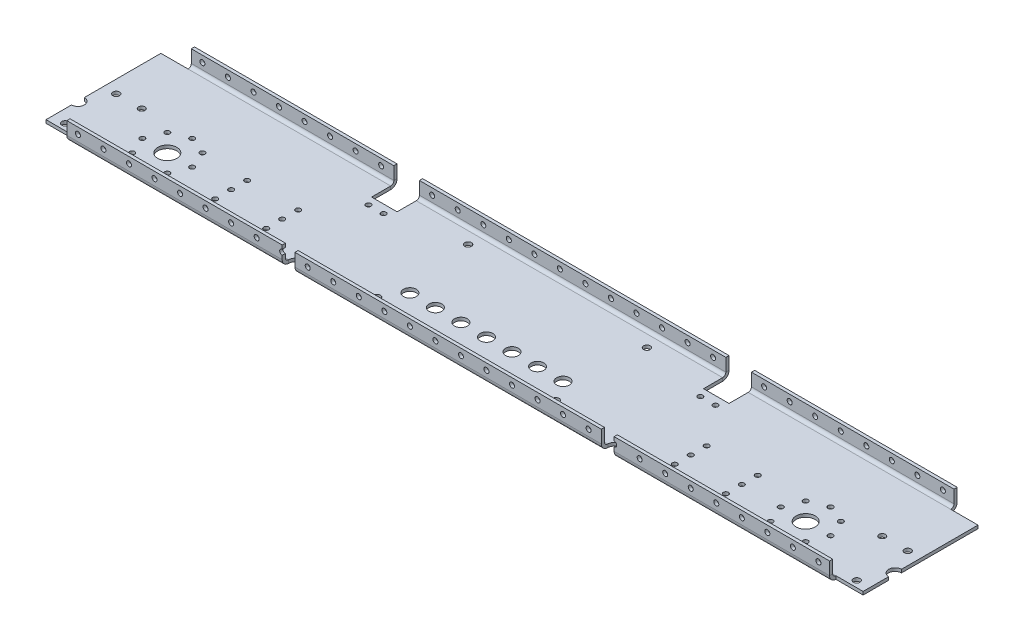
from build123d import *

# Parameters (mm, degrees)
SKETCH1_W                      = 812.8
SKETCH1_H                      = 127
BASE_FLANGE1_DEPTH             = 3.175
EDGE_FLANGE1_STRIP_W           = 19.05
EDGE_FLANGE1_STRIP_H           = 3.175
EDGE_FLANGE1_STRIP_CUT_DEPTH   = 812.8
EDGE_FLANGE1_STRIP_2_W         = 19.05
EDGE_FLANGE1_STRIP_2_H         = 3.175
EDGE_FLANGE1_STRIP_CUT_2_DEPTH = 812.8
EDGE_FLANGE1_DEPTH             = 812.8
EDGE_FLANGE1_BEND_DEPTH        = 812.8
MOUNTING_HOLES_D               = 5
LPATTERN3_COUNT                = 32
LPATTERN3_PITCH                = 25.4
SKETCH21_W                     = 27.051
SKETCH21_H                     = 6.35
SKETCH21_W_2                   = 25.4
SKETCH21_H_2                   = 25.4
CUT_EXTRUDE3_DEPTH             = 412.771918057
CUT_EXTRUDE4_DEPTH             = 412.637250045
CUT_EXTRUDE4_DEPTH_BACK        = 412.637250045
F_80_20_CONNECTION_HOLES_D     = 6.6
MOTOR_HOLES_D                  = 19.05
F_1_2_0_5_DIAMETER_HOLE1_D     = 12.7
CUT_EXTRUDE5_DEPTH             = 412.637250045
CHURROW_HOLES_D                = 6.6
F_80_20_SUPPORT_HOLES_D        = 5
MOTOR_GEARBOX_MOUNTS_D         = 5
F_5_0MM_DOWEL_HOLE3_D          = 5
F_1_4_0_25_DIAMETER_HOLE1_D    = 6.35


# Sheet-metal steps are written as plain solids
with BuildPart() as part:
    # Sketch1 → Base-Flange1 (new body)
    with BuildSketch(Plane(origin=(0, 0, 0), x_dir=(1, 0, 0), z_dir=(0, 1, 0))):
        Rectangle(SKETCH1_W, SKETCH1_H)
    extrude(amount=-BASE_FLANGE1_DEPTH)

    # Edge-Flange1 strip (across the edge) → Edge-Flange1 strip cut (cut)
    with BuildSketch(Plane(origin=(406.4, 0, -63.5), x_dir=(0, 0, 1), z_dir=(-1, 0, 0))):
        with Locations((-3.175, -1.5875)):
            Rectangle(EDGE_FLANGE1_STRIP_W, EDGE_FLANGE1_STRIP_H)
    extrude(amount=EDGE_FLANGE1_STRIP_CUT_DEPTH, mode=Mode.SUBTRACT)

    # Edge-Flange1 strip 2 (across the edge) → Edge-Flange1 strip cut 2 (cut)
    with BuildSketch(Plane(origin=(-406.4, 0, 63.5), x_dir=(0, 0, -1), z_dir=(1, 0, 0))):
        with Locations((-3.175, -1.5875)):
            Rectangle(EDGE_FLANGE1_STRIP_2_W, EDGE_FLANGE1_STRIP_2_H)
    extrude(amount=EDGE_FLANGE1_STRIP_CUT_2_DEPTH, mode=Mode.SUBTRACT)

    # Edge-Flange1 section (across the edge) → Edge-Flange1 (add)
    with BuildSketch(Plane(origin=(406.4, 0, -63.5), x_dir=(0, 0, 1), z_dir=(-1, 0, 0))):
        with BuildLine():
            Line((0, 3.175), (0, 15.875))
            Line((0, 15.875), (3.175, 15.875))
            Line((3.175, 15.875), (3.175, 3.175))
            ThreePointArc((3.175, 3.175), (4.10493597, 0.92993597), (6.35, 0))
            Line((6.35, 0), (6.35, -3.175))
            ThreePointArc((6.35, -3.175), (1.859871939, -1.315128061), (0, 3.175))
        make_face()
    extrude(amount=EDGE_FLANGE1_DEPTH)

    # Edge-Flange1 section 2 (across the edge) → Edge-Flange1 bend (add)
    with BuildSketch(Plane(origin=(-406.4, 0, 63.5), x_dir=(0, 0, -1), z_dir=(1, 0, 0))):
        with BuildLine():
            Line((0, 3.175), (0, 15.875))
            Line((0, 15.875), (3.175, 15.875))
            Line((3.175, 15.875), (3.175, 3.175))
            ThreePointArc((3.175, 3.175), (4.10493597, 0.92993597), (6.35, 0))
            Line((6.35, 0), (6.35, -3.175))
            ThreePointArc((6.35, -3.175), (1.859871939, -1.315128061), (0, 3.175))
        make_face()
    extrude(amount=EDGE_FLANGE1_BEND_DEPTH)

    # Mounting Holes (through all)
    with Locations(Plane(origin=(342.9, 0, -63.5), x_dir=(1, 0, 0), z_dir=(0, 0, -1))):
        with Locations((-736.6, -9.525)):
            mounting_holes = Hole(MOUNTING_HOLES_D / 2)

    # LPattern3: Mounting Holes ×32
    with Locations(*[(i * LPATTERN3_PITCH, 0, 0) for i in range(1, LPATTERN3_COUNT)]):
        add(mounting_holes, mode=Mode.SUBTRACT)

    # Sketch21 → Cut-Extrude3 (cut, through all)
    with BuildSketch(Plane.XZ.offset(3.175)):
        with Locations((-392.8745, -60.325)):
            Rectangle(SKETCH21_W, SKETCH21_H)
        with Locations((165.1, -50.8)):
            Rectangle(SKETCH21_W_2, SKETCH21_H_2)
        with Locations((-165.1, -50.8)):
            Rectangle(SKETCH21_W_2, SKETCH21_H_2)
        with Locations((-392.8745, 60.325)):
            Rectangle(SKETCH21_W, SKETCH21_H)
        with Locations((392.8745, -60.325)):
            Rectangle(SKETCH21_W, SKETCH21_H)
        with Locations((392.8745, 60.325)):
            Rectangle(SKETCH21_W, SKETCH21_H)
    extrude(amount=-CUT_EXTRUDE3_DEPTH, mode=Mode.SUBTRACT)

    # Sketch26 → Cut-Extrude4 (cut, two sides: drawn at the far end of the back side and taken through both)
    with BuildSketch(Plane(origin=(0, 0, 0), x_dir=(1, 0, 0), z_dir=(0, 1, 0)).offset(-CUT_EXTRUDE4_DEPTH_BACK)):
        with BuildLine():
            Line((152.4, -57.15), (152.4, -63.5))
            Line((152.4, -63.5), (165.1, -63.5))
            Line((165.1, -63.5), (165.1, -57.15))
            ThreePointArc((165.1, -57.15), (158.75, -50.8), (152.4, -57.15))
        make_face()
        with BuildLine():
            Line((-165.1, -57.15), (-165.1, -63.5))
            Line((-165.1, -63.5), (-152.4, -63.5))
            Line((-152.4, -63.5), (-152.4, -57.15))
            ThreePointArc((-152.4, -57.15), (-158.75, -50.8), (-165.1, -57.15))
        make_face()
    extrude(amount=CUT_EXTRUDE4_DEPTH + CUT_EXTRUDE4_DEPTH_BACK, mode=Mode.SUBTRACT)

    # 80/20 Connection Holes (through all)
    with Locations(Plane(origin=(0, 0, 0), x_dir=(1, 0, 0), z_dir=(0, 1, 0))):
        with Locations((-393.7, 0), (-393.7, -50.8), (393.7, -50.8), (393.7, 0)):
            Hole(F_80_20_CONNECTION_HOLES_D / 2)

    # Motor Holes (through all)
    with Locations(Plane(origin=(0, 0, 0), x_dir=(1, 0, 0), z_dir=(0, 1, 0))):
        with Locations((-317.5, -25.4), (317.5, -25.4)):
            Hole(MOTOR_HOLES_D / 2)

    # 1/2 (0.5) Diameter Hole1 (through all)
    with Locations(Plane(origin=(0, 0, 0), x_dir=(1, 0, 0), z_dir=(0, 1, 0))):
        with Locations((76.2, -25.4), (0, -25.4), (-25.4, -25.4), (-50.8, -25.4), (-76.2, -25.4), (25.4, -25.4), (50.8, -25.4)):
            Hole(F_1_2_0_5_DIAMETER_HOLE1_D / 2)

    # Sketch33 → Cut-Extrude5 (cut, through all)
    with BuildSketch(Plane(origin=(0, 0, 0), x_dir=(1, 0, 0), z_dir=(0, 1, 0))):
        with BuildLine():
            Line((-406.4, -19.05), (-406.4, -31.75))
            ThreePointArc((-406.4, -31.75), (-400.05, -25.4), (-406.4, -19.05))
        make_face()
        with BuildLine():
            Line((406.4, -19.05), (406.4, -31.75))
            ThreePointArc((406.4, -31.75), (400.05, -25.4), (406.4, -19.05))
        make_face()
    extrude(amount=-CUT_EXTRUDE5_DEPTH, mode=Mode.SUBTRACT)

    # Churrow Holes (through all)
    with Locations(Plane(origin=(0, 0, 0), x_dir=(1, 0, 0), z_dir=(0, 1, 0))):
        with Locations((88.9, -45.28), (-88.9, 45.28), (-88.9, -45.28), (88.9, 45.28)):
            Hole(CHURROW_HOLES_D / 2)

    # 80/20 Support Holes (through all)
    with Locations(Plane(origin=(0, 0, 0), x_dir=(1, 0, 0), z_dir=(0, 1, 0))):
        with Locations((172.6, 29.8), (-172.6, 29.8), (-157.6, 29.8), (157.6, 29.8)):
            Hole(F_80_20_SUPPORT_HOLES_D / 2)

    # Motor Gearbox Mounts (through all)
    with Locations(Plane(origin=(0, 0, 0), x_dir=(1, 0, 0), z_dir=(0, 1, 0))):
        with Locations((-299.999107166, -7.899107166), (317.5, -0.65), (299.999107166, -7.899107166), (292.75, -25.4), (299.999107166, -42.900892834), (317.5, -50.15), (335.000892834, -42.900892834), (342.25, -25.4), (335.000892834, -7.899107166), (-317.5, -0.65), (-335.000892834, -7.899107166), (-342.25, -25.4), (-335.000892834, -42.900892834), (-317.5, -50.15), (-299.999107166, -42.900892834), (-292.75, -25.4)):
            Hole(MOTOR_GEARBOX_MOUNTS_D / 2)

    # Ø5.0mm Dowel Hole3 (through all)
    with Locations(Plane(origin=(0, 0, 0), x_dir=(1, 0, 0), z_dir=(0, 1, 0))):
        with Locations((203.2, -41.275), (-254, -25.4), (-203.2, -25.4), (-254, -9.525), (-203.2, -9.525), (-203.2, -41.275), (-254, -41.275), (254, -25.4), (203.2, -25.4), (203.2, -9.525), (254, -9.525), (254, -41.275)):
            Hole(F_5_0MM_DOWEL_HOLE3_D / 2)

    # 1/4 (0.25) Diameter Hole1 (through all)
    with Locations(Plane(origin=(0, -3.175, 0), x_dir=(-1, 0, 0), z_dir=(0, -1, 0))):
        with Locations((-368.3, 0), (368.3, 0)):
            Hole(F_1_4_0_25_DIAMETER_HOLE1_D / 2)


solid = part.part
